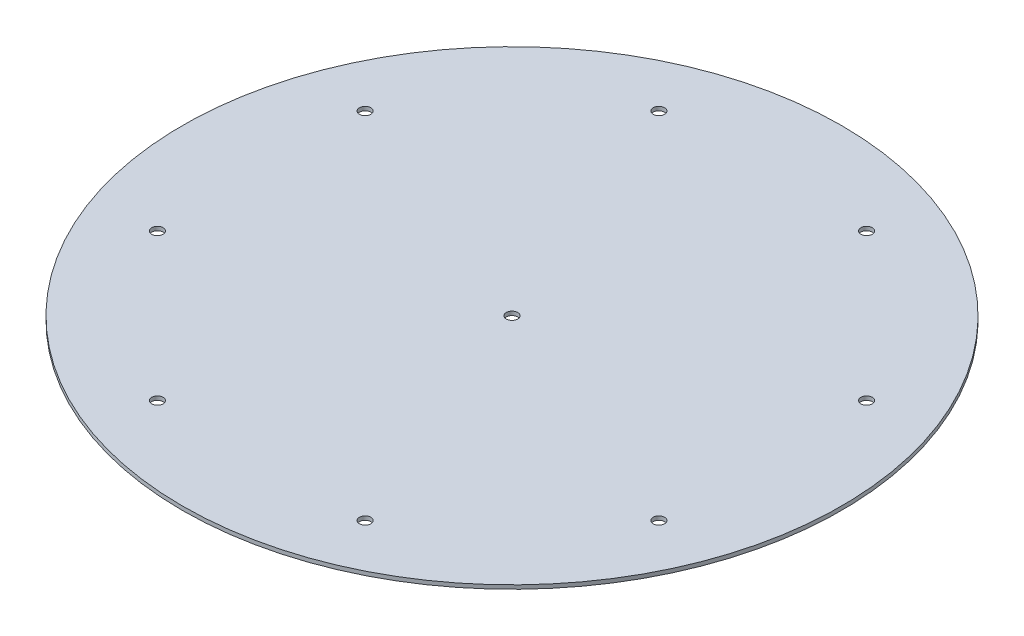
from build123d import *

# Parameters (mm, degrees)
SKETCH2_W                   = 84.99983
SKETCH2_H                   = 1
F_32_0_116_DIAMETER_HOLE1_D = 2.9464
CIRPATTERN3_COUNT           = 8
F_32_0_116_DIAMETER_HOLE2_D = 2.9464


with BuildPart() as part:
    # Sketch2 → Revolve1 (revolve)
    with BuildSketch(Plane(origin=(0, 0, 0), x_dir=(0, 0, -1), z_dir=(1, 0, 0))):
        with Locations((-42.499915, 0.5)):
            Rectangle(SKETCH2_W, SKETCH2_H)
    revolve(axis=Axis((0, -0.75, 0), (0, 1, 0)))

    # #32 (0.116) Diameter Hole1 (through all)
    with Locations(Plane(origin=(0, 1, 0), x_dir=(1, 0, 0), z_dir=(0, 1, 0))):
        with Locations((-26.787840266, 64.671567276)):
            f_32_0_116_diameter_hole1 = Hole(F_32_0_116_DIAMETER_HOLE1_D / 2)

    # CirPattern3: #32 (0.116) Diameter Hole1 ×8 about axis
    cirpattern3_axis = Axis((0, -0.75, 0), (0, 1, 0))
    for i in range(1, CIRPATTERN3_COUNT):
        add(f_32_0_116_diameter_hole1.rotate(cirpattern3_axis, i * 360 / CIRPATTERN3_COUNT), mode=Mode.SUBTRACT)

    # #32 (0.116) Diameter Hole2 (through all)
    with Locations(Plane(origin=(0, 1, 0), x_dir=(1, 0, 0), z_dir=(0, 1, 0))):
        with Locations((0, 0)):
            Hole(F_32_0_116_DIAMETER_HOLE2_D / 2)


solid = part.part
